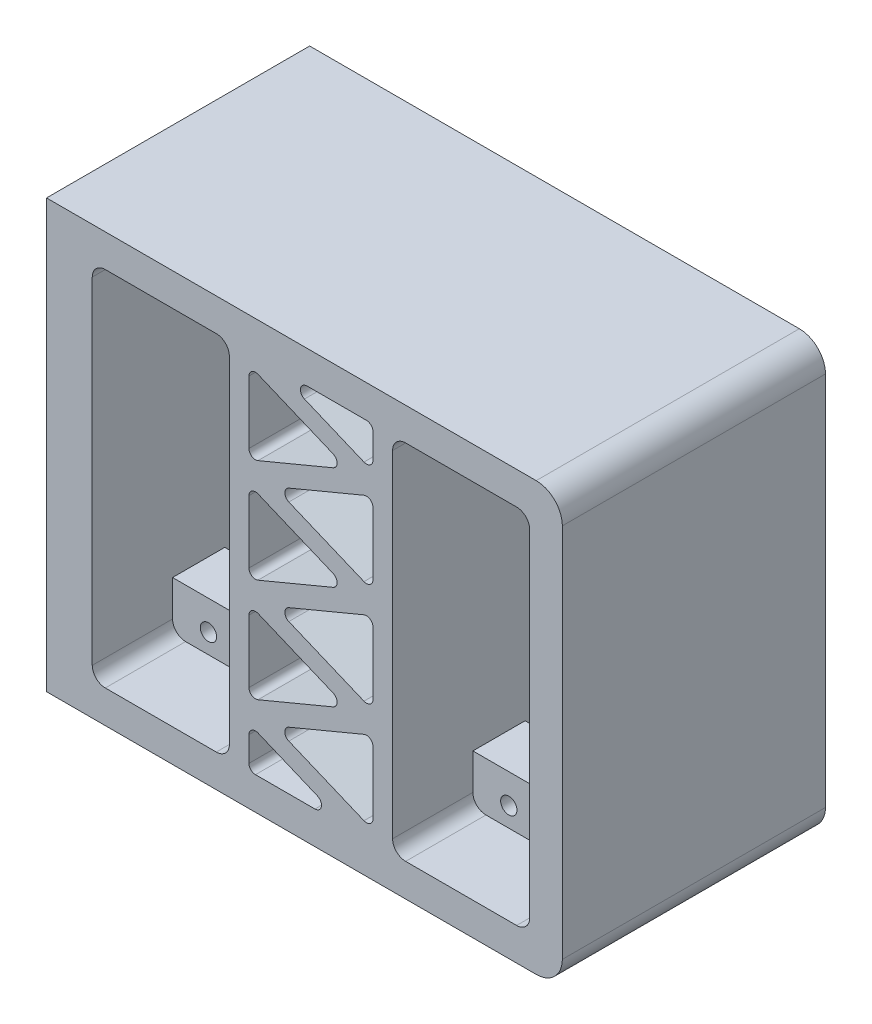
from build123d import *

# Parameters (mm, degrees)
SKETCH1_W           = 77
SKETCH1_H           = 65.5
SKETCH1_W_2         = 21
SKETCH1_H_2         = 40.5
BOSS_EXTRUDE2_DEPTH = 28
SKETCH1_4_W         = 77
SKETCH1_4_H         = 65.5
BOSS_EXTRUDE4_DEPTH = 12.3
SKETCH1_5_R         = 1.25
CUT_EXTRUDE1_DEPTH  = 12
CUT_EXTRUDE2_DEPTH  = 109.827110593
FILLET4_R           = 1
SKETCH8_W           = 21
SKETCH8_H           = 20
SKETCH8_W_2         = 16
CUT_EXTRUDE8_DEPTH  = 10
BOSS_EXTRUDE5_DEPTH = 1.5
BOSS_EXTRUDE6_DEPTH = 1.5
SKETCH13_W          = 40.3
SKETCH13_H          = 65.5
BOSS_EXTRUDE7_DEPTH = 2
FILLET3_R           = 2
SKETCH14_R          = 1.25
CUT_EXTRUDE9_DEPTH  = 7
FILLET7_R           = 4


with BuildPart() as part:
    # Sketch1 → Boss-Extrude2 (new body)
    with BuildSketch(Plane.XY):
        with Locations((38.5, 32.75)):
            Rectangle(SKETCH1_W, SKETCH1_H)
        with Locations((15.5, 32.75)):
            Rectangle(SKETCH1_W_2, SKETCH1_H_2, mode=Mode.SUBTRACT)
        with Locations((61.5, 32.75)):
            Rectangle(SKETCH1_W_2, SKETCH1_H_2, mode=Mode.SUBTRACT)
    extrude(amount=-BOSS_EXTRUDE2_DEPTH)

    # Sketch1<4> → Boss-Extrude4 (add)
    with BuildSketch(Plane.XY):
        with Locations((38.5, 32.75)):
            Rectangle(SKETCH1_4_W, SKETCH1_4_H)
        Polygon((5, 53), (5, 60.5), (26, 60.5), (26, 53), (26, 12.5), (26, 5), (5, 5), (5, 12.5), align=None, mode=Mode.SUBTRACT)
        Polygon((51, 53), (51, 60.5), (72, 60.5), (72, 53), (72, 12.5), (72, 5), (51, 5), (51, 12.5), align=None, mode=Mode.SUBTRACT)
    extrude(amount=BOSS_EXTRUDE4_DEPTH)

    # Sketch1<5> → Cut-Extrude1 (cut)
    with BuildSketch(Plane.XY):
        with Locations((10.5, 57.5)):
            Circle(SKETCH1_5_R)
        with Locations((20.5, 57.5)):
            Circle(SKETCH1_5_R)
        with Locations((10.5, 8)):
            Circle(SKETCH1_5_R)
        with Locations((20.5, 8)):
            Circle(SKETCH1_5_R)
        with Locations((56.5, 57.5)):
            Circle(SKETCH1_5_R)
        with Locations((66.5, 57.5)):
            Circle(SKETCH1_5_R)
        with Locations((66.5, 8)):
            Circle(SKETCH1_5_R)
        with Locations((56.5, 8)):
            Circle(SKETCH1_5_R)
    extrude(amount=-CUT_EXTRUDE1_DEPTH, mode=Mode.SUBTRACT)

    # Sketch5 → Cut-Extrude2 (cut, through all)
    with BuildSketch(Plane.XY.offset(12.3)):
        Polygon((44.10498905, 52.571428571), (29, 58.874638288), (29, 46.268218855), align=None)
        Polygon((48, 60.5), (32.89501095, 60.5), (48, 54.196790284), align=None)
        Polygon((44.10498905, 36.714285714), (29, 43.017495431), (29, 30.411075998), align=None)
        Polygon((48, 38.339647426), (48, 50.946066859), (32.89501095, 44.642857143), align=None)
        Polygon((48, 22.482504569), (48, 35.088924002), (32.89501095, 28.785714286), align=None)
        Polygon((44.10498905, 20.857142857), (29, 27.160352574), (29, 14.553933141), align=None)
        Polygon((48, 6.625361712), (48, 19.231781145), (32.89501095, 12.928571429), align=None)
        Polygon((44.10498905, 5), (29, 11.303209716), (29, 5), align=None)
    extrude(amount=-CUT_EXTRUDE2_DEPTH, mode=Mode.SUBTRACT)

    # Fillet4
    fillet4_edges = [part.edges().sort_by_distance(p)[0] for p in [
        (44.10498905, 5, -7.85),
        (29, 11.303209716, -7.85),
        (29, 5, -7.85),
        (48, 6.625361712, -7.85),
        (48, 19.231781145, -7.85),
        (32.89501095, 12.928571429, -7.85),
        (29, 14.553933141, -7.85),
        (29, 27.160352574, -7.85),
        (44.10498905, 20.857142857, -7.85),
        (48, 22.482504569, -7.85),
        (48, 35.088924002, -7.85),
        (32.89501095, 28.785714286, -7.85),
        (44.10498905, 36.714285714, -7.85),
        (29, 30.411075998, -7.85),
        (29, 43.017495431, -7.85),
        (48, 38.339647426, -7.85),
        (32.89501095, 44.642857143, -7.85),
        (48, 50.946066859, -7.85),
        (29, 46.268218855, -7.85),
        (44.10498905, 52.571428571, -7.85),
        (29, 58.874638288, -7.85),
        (48, 54.196790284, -7.85),
        (48, 60.5, -7.85),
        (32.89501095, 60.5, -7.85),
    ]]
    fillet(fillet4_edges, radius=FILLET4_R)

    # Sketch8 → Cut-Extrude8 (cut)
    with BuildSketch(Plane(origin=(0, 12.5, 0), x_dir=(1, 0, 0), z_dir=(0, 1, 0))):
        with Locations((15.5, 18)):
            Rectangle(SKETCH8_W, SKETCH8_H)
        with Locations((59, 18)):
            Rectangle(SKETCH8_W_2, SKETCH8_H)
    cut_extrude8 = extrude(amount=-CUT_EXTRUDE8_DEPTH, mode=Mode.SUBTRACT)

    # Sketch10 → Boss-Extrude5 (add, symmetric)
    with BuildSketch(Plane(origin=(61.5, 0, 0), x_dir=(0, 0, -1), z_dir=(1, 0, 0))):
        Polygon((8, 2.5), (18, 2.5), (8, 12.5), align=None)
    boss_extrude5 = extrude(amount=BOSS_EXTRUDE5_DEPTH, both=True)

    # Sketch11 → Boss-Extrude6 (add, symmetric)
    with BuildSketch(Plane(origin=(15.5, 0, 0), x_dir=(0, 0, -1), z_dir=(1, 0, 0))):
        Polygon((8, 2.5), (18, 2.5), (8, 12.5), align=None)
    boss_extrude6 = extrude(amount=BOSS_EXTRUDE6_DEPTH, both=True)

    # Mirror2: Cut-Extrude8, Boss-Extrude5, Boss-Extrude6 across plane
    add(cut_extrude8.mirror(Plane.ZX.offset(32.75)), mode=Mode.SUBTRACT)
    add(boss_extrude5.mirror(Plane.ZX.offset(32.75)))
    add(boss_extrude6.mirror(Plane.ZX.offset(32.75)))

    # Sketch13 → Boss-Extrude7 (add)
    with BuildSketch(Plane.ZY):
        with Locations((-7.85, 32.75)):
            Rectangle(SKETCH13_W, SKETCH13_H)
    extrude(amount=BOSS_EXTRUDE7_DEPTH)

    # Fillet3
    fillet3_edges = [part.edges().sort_by_distance(p)[0] for p in [
        (51, 60.5, 6.15),
        (72, 5, 6.15),
        (72, 60.5, 6.15),
        (51, 5, 6.15),
        (5, 5, 6.15),
        (26, 5, 6.15),
        (26, 60.5, 6.15),
        (5, 60.5, 6.15),
        (67, 63, -18),
        (67, 2.5, -18),
        (51, 2.5, -18),
        (51, 63, -18),
        (26, 63, -18),
        (26, 2.5, -18),
        (5, 63, -18),
        (5, 2.5, -18),
    ]]
    fillet(fillet3_edges, radius=FILLET3_R)

    # Sketch14 → Cut-Extrude9 (cut)
    with BuildSketch(Plane.ZY.offset(2)):
        with Locations((-24, 61.5)):
            Circle(SKETCH14_R)
        with Locations((8.3, 61.5)):
            Circle(SKETCH14_R)
        with Locations((8.3, 4)):
            Circle(SKETCH14_R)
        with Locations((-24, 4)):
            Circle(SKETCH14_R)
    extrude(amount=-CUT_EXTRUDE9_DEPTH, mode=Mode.SUBTRACT)

    # Fillet7
    fillet7_edges = [part.edges().sort_by_distance(p)[0] for p in [
        (77, 65.5, -7.85),
        (77, 0, -7.85),
    ]]
    fillet(fillet7_edges, radius=FILLET7_R)


solid = part.part
